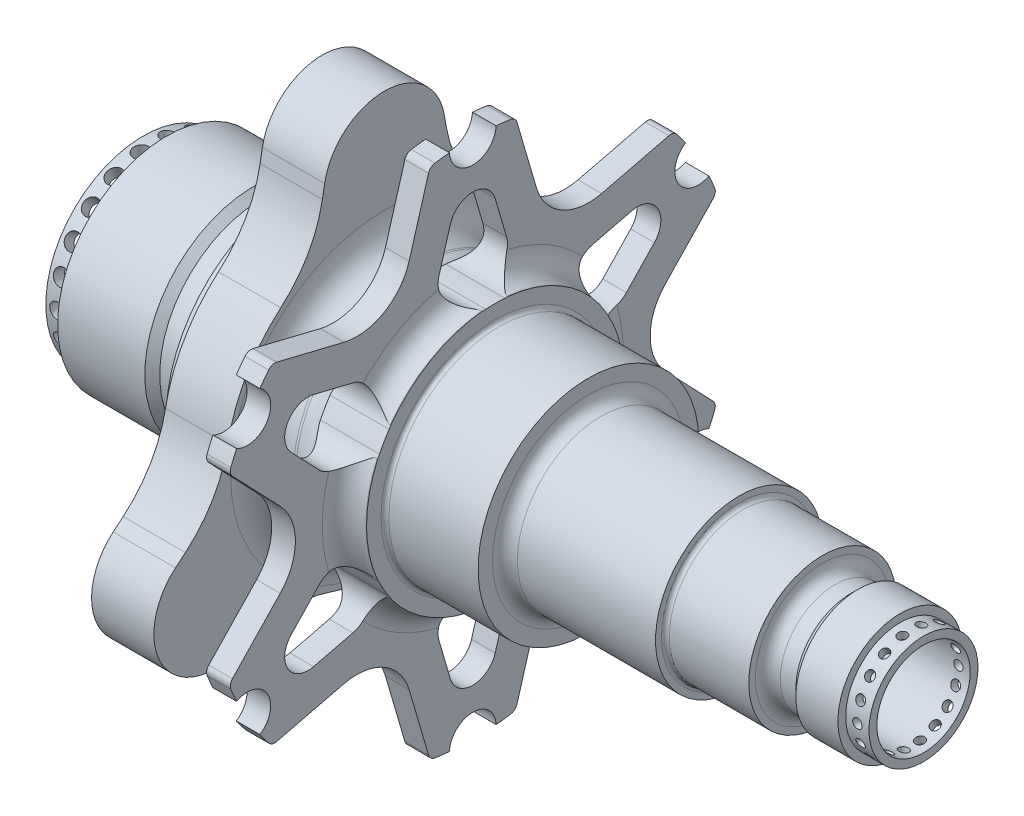
from build123d import *

# Parameters (mm, degrees)
SKETCH73_R         = 17.4625
CUT_EXTRUDE1_DEPTH = 68.8086
SKETCH75_R         = 9.525
CUT_EXTRUDE3_DEPTH = 90.3389
SKETCH74_4_R       = 0.9525
CUT_EXTRUDE4_DEPTH = 34.925
SKETCH74_R         = 1.5875
CUT_EXTRUDE2_DEPTH = 68.8086
CIRPATTERN1_COUNT  = 22
CIRPATTERN2_COUNT  = 18
CUT_EXTRUDE5_START = -12.7
CUT_EXTRUDE5_DEPTH = 12.7
SKETCH77_3_R       = 5.969
CUT_EXTRUDE6_DEPTH = 9.525
CHAMFER1_SIZE      = 0.79375
CHAMFER1_SIZE2     = 2.180810202
CUT_EXTRUDE8_START = -10
CUT_EXTRUDE8_DEPTH = 16.3500001
FILLET1_R          = 1.5875
FILLET2_R          = 6.35
FILLET4_R          = 0.8
FILLET5_R          = 0.8
FILLET6_R          = 2.54


with BuildPart() as part:
    # Sketch70 → Revolve1 (revolve)
    with BuildSketch(Plane.XY.offset(765.175), mode=Mode.PRIVATE) as revolve1_sk:
        with BuildLine():
            Line((-680.81, 223.0501), (-676.0348, 223.0501))
            Line((-676.0348, 223.0501), (-676.0348, 225.425))
            Line((-676.0348, 225.425), (-658.2548, 225.425))
            Line((-658.2548, 225.425), (-656.7308, 223.901))
            Line((-656.7308, 223.901), (-651.153708331, 223.901))
            ThreePointArc((-651.153708331, 223.901), (-649.357657106, 224.644948776), (-648.613708331, 226.441))
            Line((-648.613708331, 226.441), (-648.613708331, 230.7))
            Line((-648.613708331, 230.7), (-645.09524307, 230.7))
            ThreePointArc((-645.09524307, 230.7), (-644.533977063, 230.932483992), (-644.30149307, 231.49375))
            Line((-644.30149307, 231.49375), (-644.30149307, 255.5875))
            Line((-644.30149307, 255.5875), (-631.60149307, 255.5875))
            Line((-631.60149307, 255.5875), (-631.60149307, 234.55))
            ThreePointArc((-631.60149307, 234.55), (-629.741621131, 230.059871939), (-625.25149307, 228.2))
            Line((-625.25149307, 228.2), (-624.763, 228.2))
            ThreePointArc((-624.763, 228.2), (-620.272871939, 230.059871939), (-618.413, 234.55))
            Line((-618.413, 234.55), (-618.413, 256.286))
            Line((-618.413, 256.286), (-613.587, 256.286))
            Line((-613.587, 256.286), (-613.587, 233.895))
            ThreePointArc((-613.587, 233.895), (-612.285089642, 230.751910358), (-609.142, 229.45))
            Line((-609.142, 229.45), (-609, 229.45))
            Line((-609, 229.45), (-609, 225.7))
            Line((-609, 225.7), (-590, 225.7))
            Line((-590, 225.7), (-590, 220.218))
            Line((-590, 220.218), (-559.3, 220.218))
            Line((-559.3, 220.218), (-559.3, 218.1999954))
            Line((-559.3, 218.1999954), (-542.3, 218.1999954))
            Line((-542.3, 218.1999954), (-542.3, 216.8525))
            ThreePointArc((-542.3, 216.8525), (-541.556051224, 215.056448776), (-539.76, 214.3125))
            Line((-539.76, 214.3125), (-536.585, 214.3125))
            Line((-536.585, 214.3125), (-534.9975, 215.9))
            Line((-534.9975, 215.9), (-526.425, 215.9))
            Line((-526.425, 215.9), (-526.425, 214.3125))
            Line((-526.425, 214.3125), (-521.6625, 214.3125))
            Line((-521.6625, 214.3125), (-521.6625, 203.2))
            Line((-521.6625, 203.2), (-680.81, 203.2))
            Line((-680.81, 203.2), (-680.81, 223.0501))
        make_face()
    revolve(revolve1_sk.sketch.rotate(Axis((-521.6625, 203.2, 765.175), (-1, 0, 0)), 90), axis=Axis((-521.6625, 203.2, 765.175), (-1, 0, 0)))

    # Sketch73 → Cut-Extrude1 (cut)
    with BuildSketch(Plane(origin=(-680.81, 0, 0), x_dir=(0, 0, -1), z_dir=(1, 0, 0))):
        with Locations((-765.175, 203.2)):
            Circle(SKETCH73_R)
    extrude(amount=CUT_EXTRUDE1_DEPTH, mode=Mode.SUBTRACT)

    # Sketch75 → Cut-Extrude3 (cut)
    with BuildSketch(Plane(origin=(-521.6625, 0, 0), x_dir=(0, 0, -1), z_dir=(1, 0, 0))):
        with Locations((-765.175, 203.2)):
            Circle(SKETCH75_R)
    extrude(amount=-CUT_EXTRUDE3_DEPTH, mode=Mode.SUBTRACT)

    # Sketch74<4> → Cut-Extrude4 (cut)
    with BuildSketch(Plane.XY.offset(765.175)):
        with Locations((-524.04375, 203.2)):
            Circle(SKETCH74_4_R)
    cut_extrude4 = extrude(amount=-CUT_EXTRUDE4_DEPTH, mode=Mode.SUBTRACT)

    # Sketch74 → Cut-Extrude2 (cut)
    with BuildSketch(Plane.XY.offset(765.175)):
        with Locations((-678.4224, 203.2)):
            Circle(SKETCH74_R)
    cut_extrude2 = extrude(amount=-CUT_EXTRUDE2_DEPTH, mode=Mode.SUBTRACT)

    # CirPattern1: Cut-Extrude2 ×22 about axis
    cirpattern1_axis = Axis((-680.81, 203.2, 765.175), (1, 0, 0))
    for i in range(1, CIRPATTERN1_COUNT):
        add(cut_extrude2.rotate(cirpattern1_axis, i * 360 / CIRPATTERN1_COUNT), mode=Mode.SUBTRACT)

    # CirPattern2: Cut-Extrude4 ×18 about axis
    cirpattern2_axis = Axis((-638.942168363, 203.2, 765.175), (1, 0, 0))
    for i in range(1, CIRPATTERN2_COUNT):
        add(cut_extrude4.rotate(cirpattern2_axis, i * 360 / CIRPATTERN2_COUNT), mode=Mode.SUBTRACT)

    # Cut-Extrude5: read off the stored shape, not the designer's step
    # Cut-Extrude5 outline → Cut-Extrude5 (cut)
    with BuildSketch(Plane.ZY.offset(644.30149307).offset(CUT_EXTRUDE5_START)):
        with BuildLine():
            ThreePointArc((786.317119554, 227.883208478), (793.320825623, 219.45), (797.122345366, 209.168008385))
            ThreePointArc((797.122345366, 209.168008385), (800.158089777, 201.020808256), (805.763619227, 194.374707621))
            Line((805.763619227, 194.374707621), (807.779663855, 192.683045317))
            ThreePointArc((807.779663855, 192.683045317), (812.01472828, 185.347698559), (810.54390584, 177.006249997))
            ThreePointArc((810.54390584, 177.006249997), (810.543905841, 229.393749999), (765.175, 255.5875))
            ThreePointArc((765.175, 255.5875), (773.134317577, 252.690545317), (777.369382002, 245.35519856))
            Line((777.369382002, 245.35519856), (777.826382217, 242.763421545))
            ThreePointArc((777.826382217, 242.763421545), (780.779309479, 234.585840322), (786.317119554, 227.883208478))
        make_face()
        with BuildLine():
            ThreePointArc((719.806094153, 177.00625001), (765.174999993, 150.8125), (810.543905839, 177.006249998))
            ThreePointArc((810.543905839, 177.006249998), (804.055410702, 171.561756123), (795.585281854, 171.561756123))
            Line((795.585281854, 171.561756123), (793.11223701, 172.461870834))
            ThreePointArc((793.11223701, 172.461870834), (784.553780299, 173.993351422), (775.980225812, 172.548783137))
            ThreePointArc((775.980225812, 172.548783137), (765.175, 170.7), (754.369774188, 172.548783137))
            ThreePointArc((754.369774188, 172.548783137), (745.796219701, 173.993351422), (737.23776299, 172.461870834))
            Line((737.23776299, 172.461870834), (734.764718146, 171.561756123))
            ThreePointArc((734.764718146, 171.561756123), (726.294589291, 171.561756125), (719.806094153, 177.00625001))
        make_face()
        with BuildLine():
            ThreePointArc((765.175, 255.5875), (719.806094162, 229.393750005), (719.806094153, 177.00625001))
            ThreePointArc((719.806094153, 177.00625001), (718.335271721, 185.347698566), (722.570336145, 192.683045317))
            Line((722.570336145, 192.683045317), (724.586380773, 194.374707621))
            ThreePointArc((724.586380773, 194.374707621), (730.191910223, 201.020808256), (733.227654634, 209.168008385))
            ThreePointArc((733.227654634, 209.168008385), (737.029174377, 219.45), (744.032880446, 227.883208478))
            ThreePointArc((744.032880446, 227.883208478), (749.570690521, 234.585840322), (752.523617783, 242.763421545))
            Line((752.523617783, 242.763421545), (752.980617998, 245.35519856))
            ThreePointArc((752.980617998, 245.35519856), (757.215682423, 252.690545317), (765.175, 255.5875))
        make_face()
    extrude(amount=CUT_EXTRUDE5_DEPTH, mode=Mode.SUBTRACT)

    # Sketch77<3> → Cut-Extrude6 (cut)
    with BuildSketch(Plane.ZY.offset(644.30149307)):
        with Locations((765.175, 243.205)):
            Circle(SKETCH77_3_R)
        with Locations((730.529653722, 183.1975)):
            Circle(SKETCH77_3_R)
        with Locations((799.820346278, 183.1975)):
            Circle(SKETCH77_3_R)
    extrude(amount=-CUT_EXTRUDE6_DEPTH, mode=Mode.SUBTRACT)

    # Chamfer1
    chamfer1_edges = [part.edges().sort_by_distance(p)[0] for p in [
        (-644.30149307, 243.205, 759.206),
        (-644.30149307, 183.1975, 724.560653722),
        (-644.30149307, 183.1975, 793.851346278),
    ]]
    chamfer1_side = [part.faces().sort_by_distance(p)[0] for p in [
        (-644.30149307, 172.752327057, 726.727921673),
    ]]
    chamfer(chamfer1_edges, length=CHAMFER1_SIZE, length2=CHAMFER1_SIZE2, reference=chamfer1_side[0])

    # Cut-Extrude8: read off the stored shape, not the designer's step
    # Cut-Extrude8 outline → Cut-Extrude8 (cut)
    with BuildSketch(Plane.ZY.offset(618.413).offset(CUT_EXTRUDE8_START)):
        with BuildLine():
            ThreePointArc((732.702455042, 227.226252684), (727.450067386, 224.9805), (728.131382339, 219.308922517))
            Line((728.131382339, 219.308922517), (733.838946213, 213.336298091))
            ThreePointArc((733.838946213, 213.336298091), (738.026913706, 211.922730921), (741.573296131, 214.56099087))
            ThreePointArc((741.573296131, 214.56099087), (742.49054708, 216.296875), (743.53524136, 217.959179688))
            ThreePointArc((743.53524136, 217.959179688), (744.046850285, 222.349566934), (740.72868146, 225.269669588))
            Line((740.72868146, 225.269669588), (732.702455042, 227.226252684))
        make_face()
        with BuildLine():
            ThreePointArc((740.72868146, 181.130330412), (744.046850285, 184.050433066), (743.53524136, 188.440820312))
            ThreePointArc((743.53524136, 188.440820312), (742.49054708, 190.103125), (741.573296131, 191.83900913))
            ThreePointArc((741.573296131, 191.83900913), (738.026913706, 194.477269079), (733.838946213, 193.063701909))
            Line((733.838946213, 193.063701909), (728.131382339, 187.091077483))
            ThreePointArc((728.131382339, 187.091077483), (727.450067386, 181.4195), (732.702455042, 179.173747316))
            Line((732.702455042, 179.173747316), (740.72868146, 181.130330412))
        make_face()
        with BuildLine():
            ThreePointArc((767.136945229, 229.320170558), (771.194936579, 231.072297855), (772.064735247, 235.405967679))
            Line((772.064735247, 235.405967679), (769.746072703, 243.335175201))
            ThreePointArc((769.746072703, 243.335175201), (765.175, 246.761), (760.603927297, 243.335175201))
            Line((760.603927297, 243.335175201), (758.285264753, 235.405967679))
            ThreePointArc((758.285264753, 235.405967679), (759.155063421, 231.072297855), (763.213054771, 229.320170558))
            ThreePointArc((763.213054771, 229.320170558), (765.175, 229.39375), (767.136945229, 229.320170558))
        make_face()
        with BuildLine():
            ThreePointArc((772.064735247, 170.994032321), (771.194936579, 175.327702145), (767.136945229, 177.079829442))
            ThreePointArc((767.136945229, 177.079829442), (765.175, 177.00625), (763.213054771, 177.079829442))
            ThreePointArc((763.213054771, 177.079829442), (759.155063421, 175.327702145), (758.285264753, 170.994032321))
            Line((758.285264753, 170.994032321), (760.603927297, 163.064824799))
            ThreePointArc((760.603927297, 163.064824799), (765.175, 159.639), (769.746072703, 163.064824799))
            Line((769.746072703, 163.064824799), (772.064735247, 170.994032321))
        make_face()
        with BuildLine():
            ThreePointArc((788.776703869, 214.56099087), (792.323086294, 211.922730921), (796.511053787, 213.336298091))
            Line((796.511053787, 213.336298091), (802.218617661, 219.308922517))
            ThreePointArc((802.218617661, 219.308922517), (802.899932614, 224.9805), (797.647544958, 227.226252684))
            Line((797.647544958, 227.226252684), (789.62131854, 225.269669588))
            ThreePointArc((789.62131854, 225.269669588), (786.303149715, 222.349566934), (786.81475864, 217.959179688))
            ThreePointArc((786.81475864, 217.959179688), (787.85945292, 216.296875), (788.776703869, 214.56099087))
        make_face()
        with BuildLine():
            ThreePointArc((796.511053787, 193.063701909), (792.323086294, 194.477269079), (788.776703869, 191.83900913))
            ThreePointArc((788.776703869, 191.83900913), (787.85945292, 190.103125), (786.81475864, 188.440820312))
            ThreePointArc((786.81475864, 188.440820312), (786.303149715, 184.050433066), (789.62131854, 181.130330412))
            Line((789.62131854, 181.130330412), (797.647544958, 179.173747316))
            ThreePointArc((797.647544958, 179.173747316), (802.899932614, 181.4195), (802.218617661, 187.091077483))
            Line((802.218617661, 187.091077483), (796.511053787, 193.063701909))
        make_face()
        with BuildLine():
            Line((752.195989616, 241.036839137), (756.44375, 255.563046793))
            ThreePointArc((756.44375, 255.563046793), (738.632812782, 249.174293836), (724.194089378, 236.944456739))
            Line((724.194089378, 236.944456739), (738.897907672, 233.359501409))
            ThreePointArc((738.897907672, 233.359501409), (747.086233169, 234.531942412), (752.195989616, 241.036839137))
        make_face()
        with BuildLine():
            ThreePointArc((769.93270627, 256.072371112), (765.175, 256.286), (760.41729373, 256.072371112))
            ThreePointArc((760.41729373, 256.072371112), (765.175, 251.5235), (769.93270627, 256.072371112))
        make_face()
        with BuildLine():
            ThreePointArc((717.007330323, 225.515891063), (723.3256214, 227.36175), (721.765036593, 233.756480049))
            ThreePointArc((721.765036593, 233.756480049), (719.201175415, 229.743), (717.007330323, 225.515891063))
        make_face()
        with BuildLine():
            ThreePointArc((806.155910622, 236.944456739), (791.717187218, 249.174293836), (773.90625, 255.563046793))
            Line((773.90625, 255.563046793), (778.154010384, 241.036839137))
            ThreePointArc((778.154010384, 241.036839137), (783.263766831, 234.531942412), (791.452092328, 233.359501409))
            Line((791.452092328, 233.359501409), (806.155910622, 236.944456739))
        make_face()
        with BuildLine():
            Line((725.917559451, 210.876878789), (715.460987916, 221.8182813))
            ThreePointArc((715.460987916, 221.8182813), (712.089000008, 203.199061485), (715.461646258, 184.57996091))
            Line((715.461646258, 184.57996091), (725.917830916, 195.52173314))
            ThreePointArc((725.917830916, 195.52173314), (728.996358506, 203.199360392), (725.917559451, 210.876878789))
        make_face()
        with BuildLine():
            ThreePointArc((813.342669677, 225.515891063), (811.148824585, 229.743), (808.584963407, 233.756480049))
            ThreePointArc((808.584963407, 233.756480049), (807.0243786, 227.36175), (813.342669677, 225.515891063))
        make_face()
        with BuildLine():
            ThreePointArc((721.765036593, 172.643519951), (723.3256214, 179.03825), (717.007330323, 180.884108937))
            ThreePointArc((717.007330323, 180.884108937), (719.201175415, 176.657), (721.765036593, 172.643519951))
        make_face()
        with BuildLine():
            ThreePointArc((814.888353742, 184.57996091), (818.260999992, 203.199061485), (814.889012084, 221.8182813))
            Line((814.889012084, 221.8182813), (804.432440549, 210.876878789))
            ThreePointArc((804.432440549, 210.876878789), (801.353641494, 203.199360392), (804.432169084, 195.52173314))
            Line((804.432169084, 195.52173314), (814.888353742, 184.57996091))
        make_face()
        with BuildLine():
            Line((738.896841301, 173.041427723), (724.192896258, 169.456992297))
            ThreePointArc((724.192896258, 169.456992297), (738.631187227, 157.226644679), (756.441898539, 150.837261962))
            Line((756.441898539, 150.837261962), (752.194651779, 165.363619802))
            ThreePointArc((752.194651779, 165.363619802), (747.085125337, 171.868697195), (738.896841301, 173.041427723))
        make_face()
        with BuildLine():
            ThreePointArc((808.584963407, 172.643519951), (811.148824585, 176.657), (813.342669677, 180.884108937))
            ThreePointArc((813.342669677, 180.884108937), (807.0243786, 179.03825), (808.584963407, 172.643519951))
        make_face()
        with BuildLine():
            ThreePointArc((769.93270627, 150.327628888), (765.175, 154.8765), (760.41729373, 150.327628888))
            ThreePointArc((760.41729373, 150.327628888), (765.175, 150.114), (769.93270627, 150.327628888))
        make_face()
        with BuildLine():
            ThreePointArc((773.908101461, 150.837261962), (791.718812773, 157.226644679), (806.157103742, 169.456992297))
            Line((806.157103742, 169.456992297), (791.453158699, 173.041427723))
            ThreePointArc((791.453158699, 173.041427723), (783.264874663, 171.868697195), (778.155348221, 165.363619802))
            Line((778.155348221, 165.363619802), (773.908101461, 150.837261962))
        make_face()
    extrude(amount=CUT_EXTRUDE8_DEPTH, mode=Mode.SUBTRACT)

    # Fillet1
    fillet1_edges = [part.edges().sort_by_distance(p)[0] for p in [
        (-616, 169.456992297, 806.157103742),
        (-616, 150.837261962, 773.908101461),
        (-616, 255.563046793, 773.90625),
        (-616, 236.944456739, 806.155910622),
        (-616, 184.57996091, 715.461646258),
        (-616, 221.8182813, 715.460987916),
        (-616, 184.57996091, 814.888353742),
        (-616, 221.8182813, 814.889012084),
        (-616, 169.456992297, 724.192896258),
        (-616, 150.837261962, 756.441898539),
        (-616, 255.563046793, 756.44375),
        (-616, 236.944456739, 724.194089378),
    ]]
    fillet(fillet1_edges, radius=FILLET1_R)

    # Fillet2
    fillet2_edges = [part.edges().sort_by_distance(p)[0] for p in [
        (-612.0014, 203.2, 782.6375),
    ]]
    fillet(fillet2_edges, radius=FILLET2_R)

    # Fillet4
    fillet4_edges = [part.edges().sort_by_distance(p)[0] for p in [
        (-559.3, 203.2, 780.1749954),
    ]]
    fillet(fillet4_edges, radius=FILLET4_R)

    # Fillet5
    fillet5_edges = [part.edges().sort_by_distance(p)[0] for p in [
        (-609, 203.2, 787.675),
    ]]
    fillet(fillet5_edges, radius=FILLET5_R)

    # Fillet6
    fillet6_edges = [part.edges().sort_by_distance(p)[0] for p in [
        (-590, 203.2, 782.193),
    ]]
    fillet(fillet6_edges, radius=FILLET6_R)


solid = part.part
